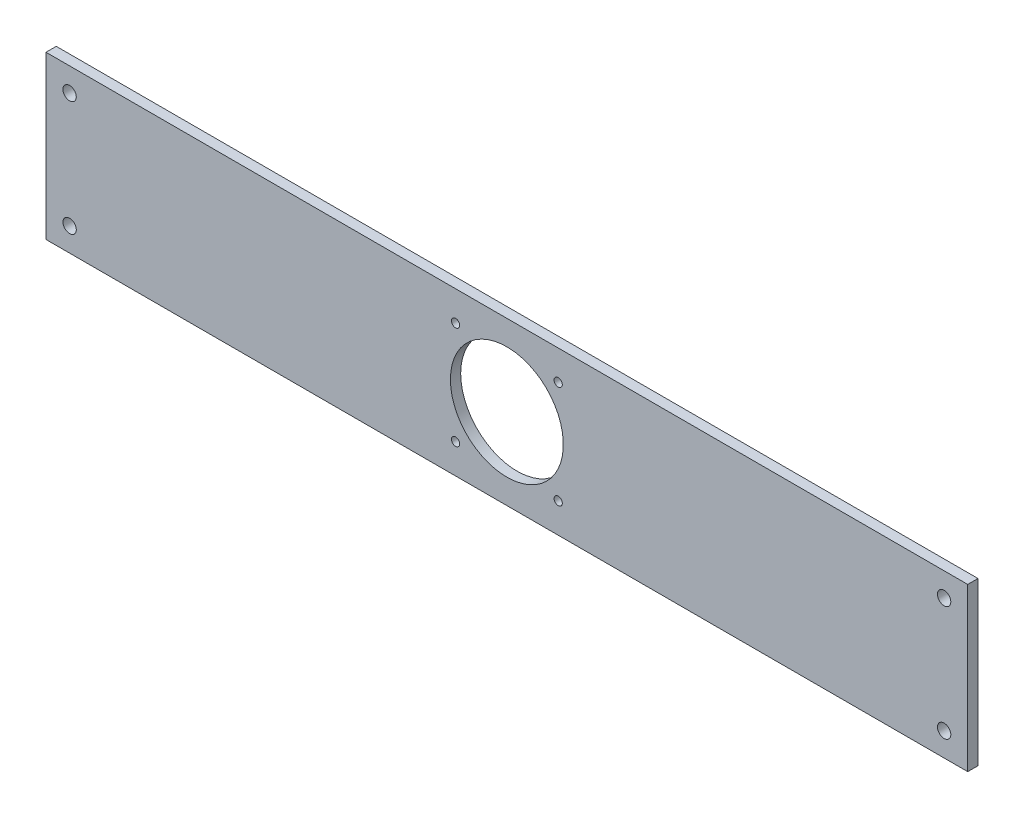
from build123d import *

# Parameters (mm, degrees)
SKETCH_F_W                   = 449
SKETCH_F_H                   = 79
SKETCH_F_R                   = 3.25
ESTRUSIONE_ESTRUSIONE1_DEPTH = 5
F_4_0_4_DIAMETER_HOLE1_D     = 4
SKETCH5_R                    = 27.5
CUT_EXTRUDE1_DEPTH           = 456.924335828


with BuildPart() as part:
    # f → Estrusione-Estrusione1 (new body)
    with BuildSketch(Plane.XY):
        with Locations((224.5, 39.5)):
            Rectangle(SKETCH_F_W, SKETCH_F_H)
        with Locations((11.5, 67.5)):
            Circle(SKETCH_F_R, mode=Mode.SUBTRACT)
        with Locations((437.5, 67.5)):
            Circle(SKETCH_F_R, mode=Mode.SUBTRACT)
        with Locations((11.5, 11.5)):
            Circle(SKETCH_F_R, mode=Mode.SUBTRACT)
        with Locations((437.5, 11.5)):
            Circle(SKETCH_F_R, mode=Mode.SUBTRACT)
    extrude(amount=ESTRUSIONE_ESTRUSIONE1_DEPTH)

    # Ø4.0 (4) Diameter Hole1 (through all)
    with Locations(Plane(origin=(0, 0, 0), x_dir=(-1, 0, 0), z_dir=(0, 0, -1))):
        with Locations((-249.5, 64.5), (-199.5, 64.5), (-249.5, 14.5), (-199.5, 14.5)):
            Hole(F_4_0_4_DIAMETER_HOLE1_D / 2)

    # Sketch5 → Cut-Extrude1 (cut, through all)
    with BuildSketch(Plane(origin=(0, 0, 0), x_dir=(-1, 0, 0), z_dir=(0, 0, -1))):
        with Locations((-224.5, 39.5)):
            Circle(SKETCH5_R)
    extrude(amount=-CUT_EXTRUDE1_DEPTH, mode=Mode.SUBTRACT)


solid = part.part
